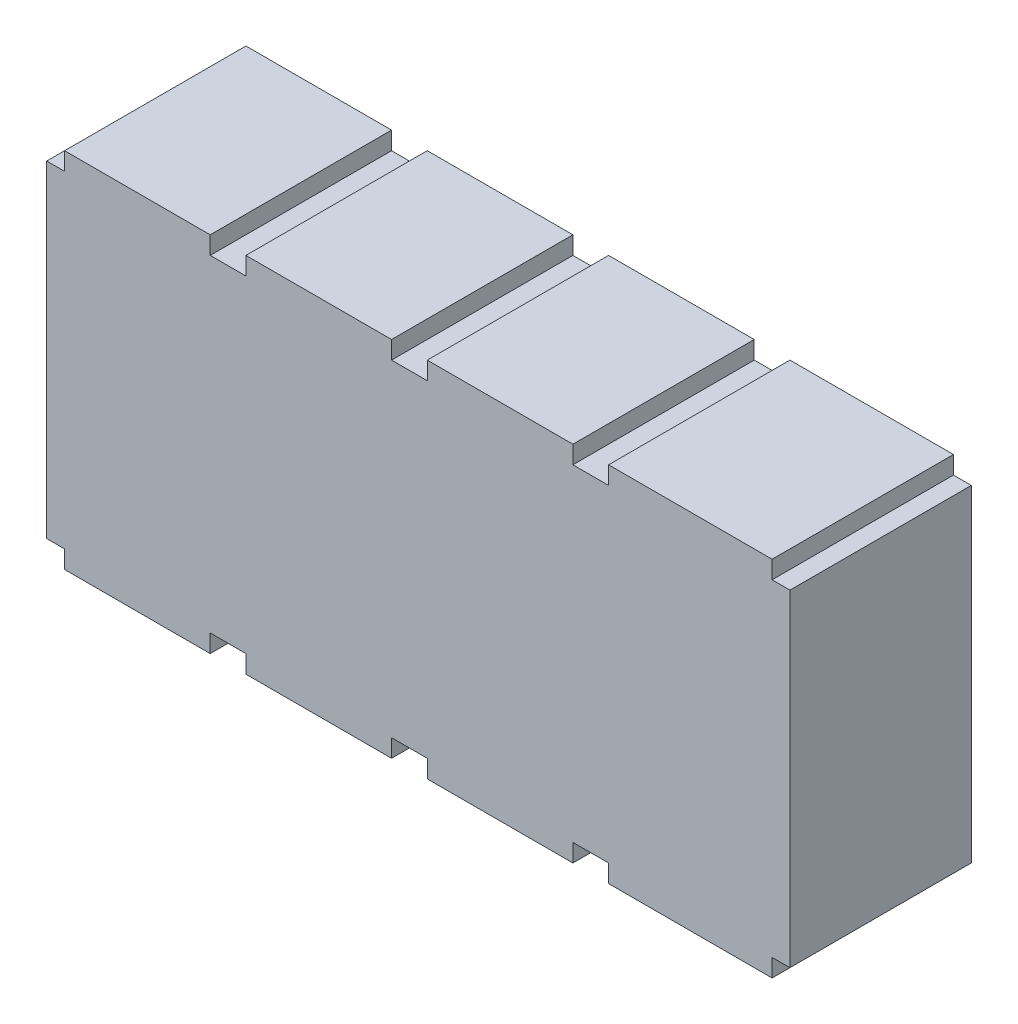
from build123d import *

# Parameters (mm, degrees)
EXTRUDE_1_DEPTH = 2.54


with BuildPart() as part:
    # 草图1 → 凸台-拉伸1 (new body)
    with BuildSketch(Plane.XY):
        Polygon((5.08, 2.29), (5.08, 2.54), (2.79, 2.54), (2.79, 2.29), (2.29, 2.29), (2.29, 2.54), (0.25, 2.54), (0.25, 2.29), (-0.25, 2.29), (-0.25, 2.54), (-2.29, 2.54), (-2.29, 2.29), (-2.79, 2.29), (-2.79, 2.54), (-4.83, 2.54), (-4.83, 2.29), (-5.08, 2.29), (-5.08, -2.29), (-4.83, -2.29), (-4.83, -2.54), (-2.79, -2.54), (-2.79, -2.29), (-2.29, -2.29), (-2.29, -2.54), (-0.25, -2.54), (-0.25, -2.29), (0.25, -2.29), (0.25, -2.54), (2.29, -2.54), (2.29, -2.29), (2.79, -2.29), (2.79, -2.54), (5.08, -2.54), (5.08, -2.29), (5.33, -2.29), (5.33, 0), (5.33, 2.29), align=None)
    extrude(amount=EXTRUDE_1_DEPTH)


solid = part.part
